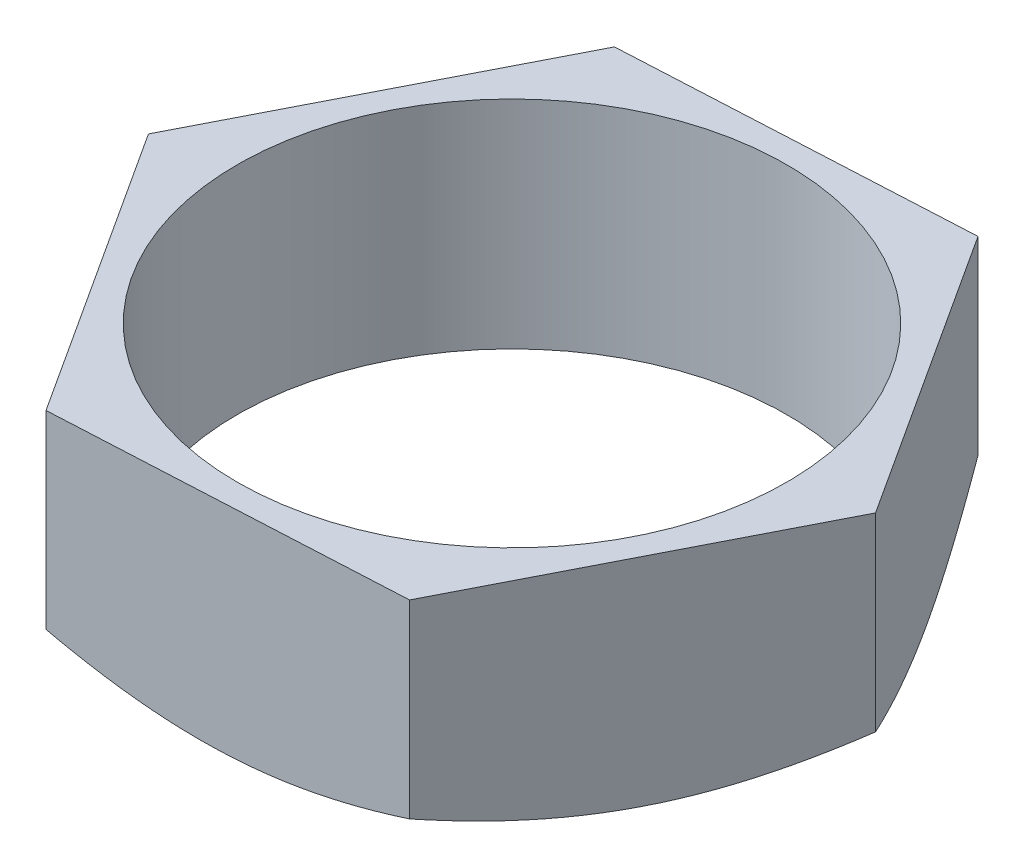
from build123d import *

# Parameters (mm, degrees)
SKETCH4_R           = 6.35
BOSS_EXTRUDE1_DEPTH = 5
SKETCH9_OUTSIDE_W   = 66.766
SKETCH9_OUTSIDE_H   = 65.032
SKETCH9_OUTSIDE_R   = 6.92820323
CUT_EXTRUDE1_DEPTH  = 12.814248327
CUT_EXTRUDE1_DRAFT  = -60


with BuildPart() as part:
    # Sketch4 → Boss-Extrude1 (new body)
    with BuildSketch(Plane(origin=(0, 0, 0), x_dir=(1, 0, 0), z_dir=(0, 1, 0))):
        Polygon((3.640964438, 7.123438633), (-4.348596599, 6.714887014), (-7.989561038, -0.408551619), (-3.640964438, -7.123438633), (4.348596599, -6.714887014), (7.989561038, 0.408551619), align=None)
        Circle(SKETCH4_R, mode=Mode.SUBTRACT)
    extrude(amount=BOSS_EXTRUDE1_DEPTH)


with BuildPart() as cut_extrude1_tool:
    # Sketch9 outside → Cut-Extrude1 (with draft: the straight prism first)
    with BuildSketch(Plane.XZ):
        Rectangle(SKETCH9_OUTSIDE_W, SKETCH9_OUTSIDE_H)
        Circle(SKETCH9_OUTSIDE_R, mode=Mode.SUBTRACT)
    extrude(amount=-CUT_EXTRUDE1_DEPTH)
    # Cut-Extrude1: the draft: its side faces are tilted about the plane it starts from
    cut_extrude1_sides = [cut_extrude1_tool.faces().sort_by_distance(p)[0] for p in [
        (0, 6.407124164, -32.516),
        (33.383, 6.407124164, 0),
        (0, 6.407124164, 32.516),
        (-33.383, 6.407124164, 0),
        (-6.92820323, 6.407124164, 0),
    ]]
    draft(cut_extrude1_sides, Plane.XZ, CUT_EXTRUDE1_DRAFT)


with BuildPart() as part_1:
    add(part.part)

    # Cut-Extrude1: cut by cut_extrude1_tool
    add(cut_extrude1_tool.part, mode=Mode.SUBTRACT)


solid = part_1.part
